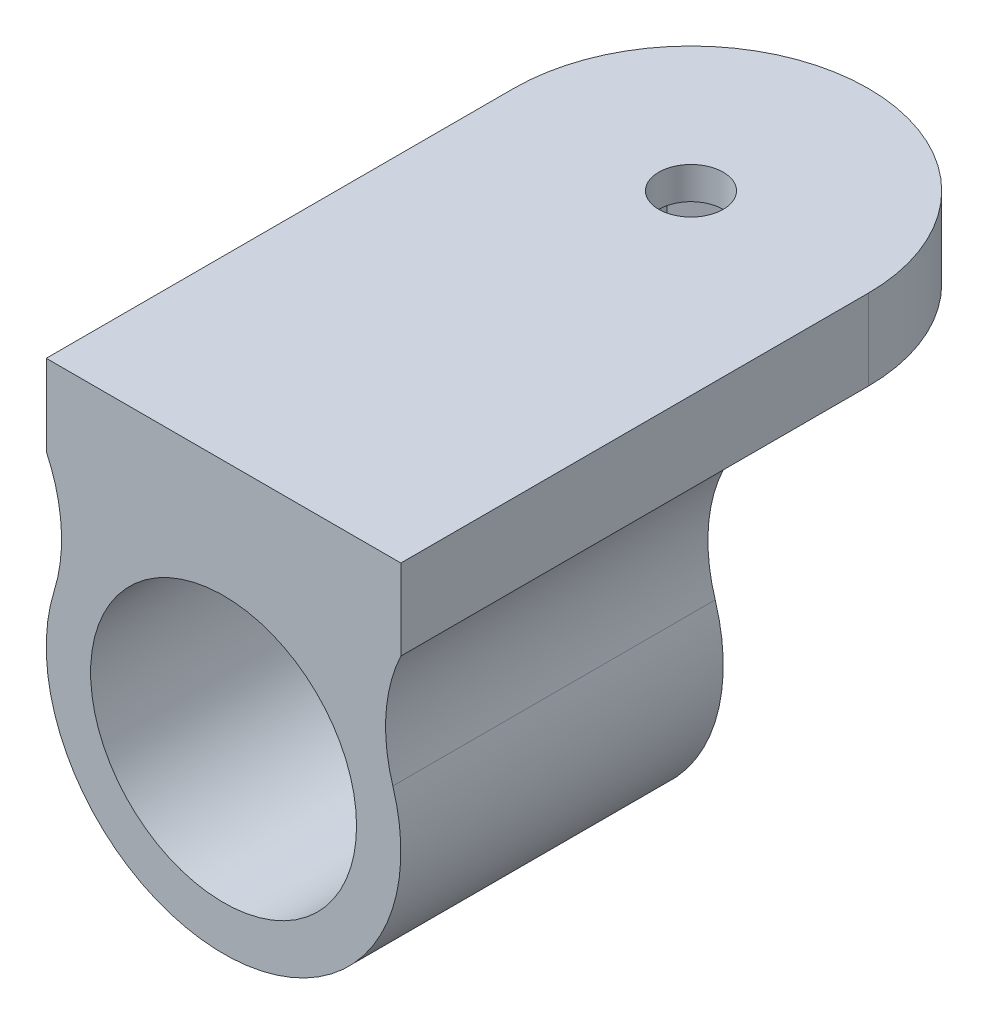
from build123d import *

# Parameters (mm, degrees)
SKETCH1_R               = 11
SKETCH1_R_2             = 8.25
BOSS_EXTRUDE1_DEPTH     = 20
BOSS_EXTRUDE2_START     = 10.5
SKETCH2_W               = 22
SKETCH2_H               = 40
BOSS_EXTRUDE2_DEPTH     = 5
FILLET1_R               = 10
CUT_EXTRUDE1_DEPTH      = 32.356817441
CUT_EXTRUDE1_DEPTH_BACK = 32.356817441
SKETCH3_R               = 2
CUT_EXTRUDE2_DEPTH      = 3


with BuildPart() as part:
    # Sketch1 → Boss-Extrude1 (new body)
    with BuildSketch(Plane.XY):
        Circle(SKETCH1_R)
        Circle(SKETCH1_R_2, mode=Mode.SUBTRACT)
    extrude(amount=BOSS_EXTRUDE1_DEPTH)

    # Sketch2 → Boss-Extrude2 (add)
    with BuildSketch(Plane(origin=(0, 0, 0), x_dir=(1, 0, 0), z_dir=(0, 1, 0)).offset(BOSS_EXTRUDE2_START)):
        Rectangle(SKETCH2_W, SKETCH2_H)
    extrude(amount=BOSS_EXTRUDE2_DEPTH)

    # Fillet1
    # the kernel refuses this fillet: 10 mm, written as the material it adds along each edge
    with BuildSketch(Plane(origin=(-3.278719262, 10.5, 20), x_dir=(-0.7068612183411899, -0.7073522587828561, 0), z_dir=(0, 0, -1))) as fillet1_piece_1:
        with BuildLine():
            CenterArc((14.864288654, 8.855683881), FILLET1_R, 199.840435799, 42.481112875)
            Line((5.45787391, 5.461665371), (5.269745615, 5.393785))
            ThreePointArc((5.269745615, 5.393785), (2.587466503, 2.872204929), (-0.141470452, 0.141372244))
            Line((-0.141470452, 0.141372244), (0.092901804, -0.177113678))
            ThreePointArc((0.092901804, -0.177113678), (5.109599225, 1.058747731), (10.126296646, -0.177113678))
            Line((10.126296646, -0.177113678), (10.21919845, 0))
        make_face()
    extrude(amount=20)
    with BuildSketch(Plane(origin=(3.278719262, 10.5, 20), x_dir=(0.7068612183411898, -0.7073522587828562, 0), z_dir=(0, 0, -1))) as fillet1_piece_2:
        with BuildLine():
            CenterArc((14.864288654, -8.855683881), FILLET1_R, 117.678451325, 42.481112875)
            Line((5.45787391, -5.461665371), (5.269745615, -5.393785))
            ThreePointArc((5.269745615, -5.393785), (2.587466503, -2.872204929), (-0.141470452, -0.141372244))
            Line((-0.141470452, -0.141372244), (0.092901804, 0.177113678))
            ThreePointArc((0.092901804, 0.177113678), (5.109599225, -1.058747731), (10.126296646, 0.177113678))
            Line((10.126296646, 0.177113678), (10.21919845, 0))
        make_face()
    extrude(amount=20)

    # Sketch3 → Cut-Extrude1 (cut, two sides: drawn at the far end of the back side and taken through both)
    with BuildSketch(Plane.XZ.offset(-10.5).offset(-CUT_EXTRUDE1_DEPTH_BACK)):
        with Locations(Location((0, -9, 0), (0, 0, 270))):
            Circle(SKETCH3_R)
        with BuildLine():
            Line((-11, -9), (-17.508128505, -13.92083612))
            Line((-17.508128505, -13.92083612), (-14.254064253, -21.523754309))
            Line((-14.254064253, -21.523754309), (21.256045922, -20))
            Line((21.256045922, -20), (18.95789911, -14.630523296))
            Line((18.95789911, -14.630523296), (11, -9))
            ThreePointArc((11, -9), (0, -20), (-11, -9))
        make_face()
    extrude(amount=CUT_EXTRUDE1_DEPTH + CUT_EXTRUDE1_DEPTH_BACK, mode=Mode.SUBTRACT)

    # Sketch4 → Cut-Extrude2 (cut)
    with BuildSketch(Plane.XZ.offset(-10.5)):
        Polygon((3.5, -6.979274058), (0, -4.958548116), (-3.5, -6.979274058), (-3.5, -11.020725942), (0, -13.041451884), (3.5, -11.020725942), align=None)
    extrude(amount=-CUT_EXTRUDE2_DEPTH, mode=Mode.SUBTRACT)


solid = part.part
